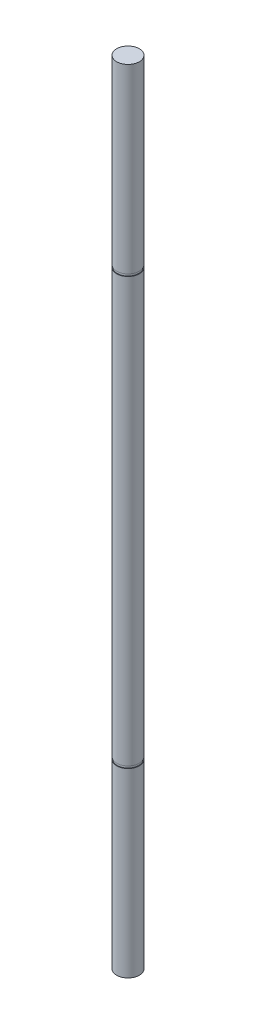
from build123d import *

# Parameters (mm, degrees)
SKETCH_1_R      = 4
EXTRUDE_1_DEPTH = 140
SKETCH_3_W      = 5
SKETCH_3_H      = 0.8


with BuildPart() as part:
    # 草图1 → 凸台-拉伸1 (new, symmetric)
    with BuildSketch(Plane(origin=(0, 0, 0), x_dir=(1, 0, 0), z_dir=(0, 1, 0))):
        Circle(SKETCH_1_R)
    extrude(amount=EXTRUDE_1_DEPTH, both=True)

    # 草图3 → 切除-旋转1 (revolve, cut)
    with BuildSketch(Plane(origin=(0, 0, 0), x_dir=(0, 0, -1), z_dir=(1, 0, 0))):
        with Locations((6.3, 75.4)):
            Rectangle(SKETCH_3_W, SKETCH_3_H)
    cut_revolve_1 = revolve(axis=Axis((0, 140, 0), (0, -1, 0)), mode=Mode.SUBTRACT)

    # 镜向1: 切除-旋转1 across plane
    add(cut_revolve_1.mirror(Plane.ZX), mode=Mode.SUBTRACT)


solid = part.part
